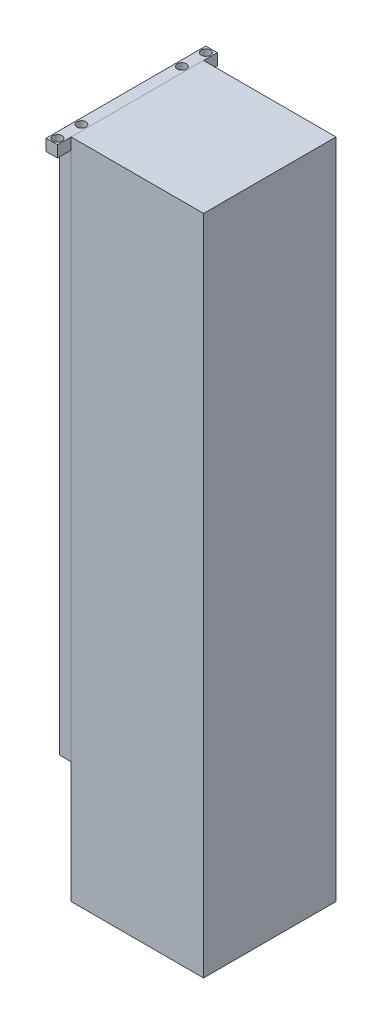
from build123d import *
from OCP.BRepFilletAPI import BRepFilletAPI_MakeChamfer

# Parameters (mm, degrees)
ESQUISSE1_W              = 58
ESQUISSE1_H              = 58
BOSS_EXTRU_2_DEPTH       = 58
BOSS_EXTRU_3_DEPTH       = 5
BOSS_EXTRU_4_DEPTH       = 2
ESQUISSE11_R             = 2
ENL_V_MAT_EXTRU_18_DEPTH = 5
ESQUISSE12_R             = 2
ENL_V_MAT_EXTRU_19_DEPTH = 5
ESQUISSE13_R             = 2
ENL_V_MAT_EXTRU_20_DEPTH = 298.800268637
ESQUISSE14_W             = 10
ESQUISSE14_H             = 195
ENL_V_MAT_EXTRU_21_DEPTH = 3
ESQUISSE15_W             = 7.5
ESQUISSE15_H             = 195
ENL_V_MAT_EXTRU_22_DEPTH = 303.978547095
CHANFREIN3_SIZE          = 1
CHANFREIN3_SIZE2         = 2.5
CHANFREIN4_SIZE2         = 1
CHANFREIN4_SIZE          = 2.5
ESQUISSE16_R             = 2
ENL_V_MAT_EXTRU_23_DEPTH = 5
ESQUISSE17_W             = 2.5
ESQUISSE17_H             = 195
ENL_V_MAT_EXTRU_24_DEPTH = 304.586890363
ESQUISSE18_R             = 6.5
ESQUISSE18_R_2           = 4
ENL_V_MAT_EXTRU_25_DEPTH = 3
ENL_V_MAT_EXTRU_26_DEPTH = 304.586890363


with BuildPart() as part:
    # Esquisse1 → Boss.-Extru.2 (new body)
    with BuildSketch(Plane.XY):
        with Locations((29, 261)):
            Rectangle(ESQUISSE1_W, ESQUISSE1_H)
        with Locations((29, 203)):
            Rectangle(ESQUISSE1_W, ESQUISSE1_H)
        with Locations((29, 145)):
            Rectangle(ESQUISSE1_W, ESQUISSE1_H)
        with Locations((29, 87)):
            Rectangle(ESQUISSE1_W, ESQUISSE1_H)
        with Locations((29, 29)):
            Rectangle(ESQUISSE1_W, ESQUISSE1_H)
    extrude(amount=BOSS_EXTRU_2_DEPTH)


with BuildPart() as body_2:
    # Esquisse3 → Boss.-Extru.3 (new body)
    with BuildSketch(Plane.ZY):
        Polygon((64, 290), (-6, 290), (-6, 285), (0, 285), (0, 220), (-11, 220), (-11, 53.018562931), (58, 53.018562931), (58, 285), (64, 285), align=None)
        Polygon((53, 285), (53, 158), (5, 158), (5, 285), (10, 285), (10, 288), (48, 288), (48, 285), align=None, mode=Mode.SUBTRACT)
    extrude(amount=BOSS_EXTRU_3_DEPTH)

    # Esquisse11 → Enlèv. mat.-Extru.18 (cut)
    with BuildSketch(Plane(origin=(0, 158, 0), x_dir=(1, 0, 0), z_dir=(0, 1, 0))):
        with Locations(Location((-2.5, -51, 0), (0, 0, 270))):
            Circle(ESQUISSE11_R)
    extrude(amount=-ENL_V_MAT_EXTRU_18_DEPTH, mode=Mode.SUBTRACT)

    # Esquisse12 → Enlèv. mat.-Extru.19 (cut)
    with BuildSketch(Plane(origin=(0, 220, 0), x_dir=(1, 0, 0), z_dir=(0, 1, 0))):
        with Locations(Location((-2.5, 3.5, 0), (0, 0, 270))):
            Circle(ESQUISSE12_R)
    extrude(amount=-ENL_V_MAT_EXTRU_19_DEPTH, mode=Mode.SUBTRACT)

    # Esquisse13 → Enlèv. mat.-Extru.20 (cut, through all)
    with BuildSketch(Plane(origin=(0, 285, 0), x_dir=(-1, 0, 0), z_dir=(0, -1, 0))):
        with Locations(Location((2.5, -7, 0), (0, 0, 90))):
            Circle(ESQUISSE13_R)
        with Locations(Location((2.5, 3.5, 0), (0, 0, 270))):
            Circle(ESQUISSE13_R)
        with Locations(Location((2.5, -61.5, 0), (0, 0, 90))):
            Circle(ESQUISSE13_R)
        with Locations(Location((2.5, -51, 0), (0, 0, 270))):
            Circle(ESQUISSE13_R)
    extrude(amount=-ENL_V_MAT_EXTRU_20_DEPTH, mode=Mode.SUBTRACT)

    # Esquisse14 → Enlèv. mat.-Extru.21 (cut)
    with BuildSketch(Plane.ZY.offset(5)):
        with Locations((7.5, 187.5)):
            Rectangle(ESQUISSE14_W, ESQUISSE14_H)
    extrude(amount=-ENL_V_MAT_EXTRU_21_DEPTH, mode=Mode.SUBTRACT)

    # Esquisse15 → Enlèv. mat.-Extru.22 (cut, through all)
    with BuildSketch(Plane.ZY.offset(2)):
        with Locations((6.25, 187.5)):
            Rectangle(ESQUISSE15_W, ESQUISSE15_H)
    extrude(amount=-ENL_V_MAT_EXTRU_22_DEPTH, mode=Mode.SUBTRACT)

    # Chanfrein4
    chanfrein4_edges = [body_2.edges().sort_by_distance(p)[0] for p in [
        (-2, 124, 10),
    ]]
    chanfrein4_side = [body_2.faces().sort_by_distance(p)[0] for p in [
        (-2, 124, 10.02),
    ]]
    chamfer(chanfrein4_edges, length=CHANFREIN4_SIZE - 0.0001, length2=CHANFREIN4_SIZE2 - 0.0001, reference=chanfrein4_side[0])  # a hair under: the kernel refuses the full size

    # Esquisse16 → Enlèv. mat.-Extru.23 (cut)
    with BuildSketch(Plane(origin=(0, 90, 0), x_dir=(1, 0, 0), z_dir=(0, 1, 0))):
        with Locations(Location((-2.5, -7, 0), (0, 0, 90))):
            Circle(ESQUISSE16_R)
    extrude(amount=-ENL_V_MAT_EXTRU_23_DEPTH, mode=Mode.SUBTRACT)

    # Esquisse17 → Enlèv. mat.-Extru.24 (cut, through all)
    with BuildSketch(Plane.ZY.offset(5)):
        with Locations((1.25, 187.5)):
            Rectangle(ESQUISSE17_W, ESQUISSE17_H)
    extrude(amount=-ENL_V_MAT_EXTRU_24_DEPTH, mode=Mode.SUBTRACT)

    # Esquisse18 → Enlèv. mat.-Extru.25 (cut)
    with BuildSketch(Plane.ZY.offset(5)):
        with Locations((-3.71, 205)):
            Circle(ESQUISSE18_R)
        with Locations((-3.71, 205)):
            Circle(ESQUISSE18_R_2, mode=Mode.SUBTRACT)
    extrude(amount=-ENL_V_MAT_EXTRU_25_DEPTH, mode=Mode.SUBTRACT)

    # Esquisse18<2> → Enlèv. mat.-Extru.26 (cut, through all)
    with BuildSketch(Plane.ZY.offset(5)):
        with BuildLine():
            Line((0, 203.504707386), (0, 206.495292614))
            ThreePointArc((0, 206.495292614), (-7.71, 205), (0, 203.504707386))
        make_face()
        with BuildLine():
            ThreePointArc((0.29, 205), (0.216830783, 205.761577311), (0, 206.495292614))
            Line((0, 206.495292614), (0, 203.504707386))
            ThreePointArc((0, 203.504707386), (0.216830783, 204.238422689), (0.29, 205))
        make_face()
    extrude(amount=-ENL_V_MAT_EXTRU_26_DEPTH, mode=Mode.SUBTRACT)


with BuildPart() as body_3:
    # Esquisse3<3> → Boss.-Extru.4 (new body)
    with BuildSketch(Plane.ZY):
        Polygon((48, 158), (48, 285), (48, 288), (10, 288), (10, 285), (10, 158), align=None)
    extrude(amount=BOSS_EXTRU_4_DEPTH)

    # Chanfrein3: one chamfer whose edges measure the first distance from different faces: ONE call of the kernel's chamfer builder (chamfer() names one face for all edges)
    chanfrein3_edges_1 = [body_3.edges().sort_by_distance(p)[0] for p in [
        (-2, 223, 48),
    ]]
    chanfrein3_side_1 = [body_3.faces().sort_by_distance(p)[0] for p in [
        (-1, 223, 48),
    ]]
    chanfrein3_edges_2 = [body_3.edges().sort_by_distance(p)[0] for p in [
        (-2, 223, 10),
    ]]
    chanfrein3_side_2 = [body_3.faces().sort_by_distance(p)[0] for p in [
        (-1, 223, 10),
    ]]
    chanfrein3 = BRepFilletAPI_MakeChamfer(body_3.part.solid().wrapped)
    for e in chanfrein3_edges_1:
        chanfrein3.Add(CHANFREIN3_SIZE, CHANFREIN3_SIZE2, e.wrapped, chanfrein3_side_1[0].wrapped)  # the first distance lies on this face
    for e in chanfrein3_edges_2:
        chanfrein3.Add(CHANFREIN3_SIZE, CHANFREIN3_SIZE2, e.wrapped, chanfrein3_side_2[0].wrapped)  # the first distance lies on this face
    add(Compound.cast(chanfrein3.Shape()), mode=Mode.REPLACE)


solid = Compound([part.part, body_2.part, body_3.part])
